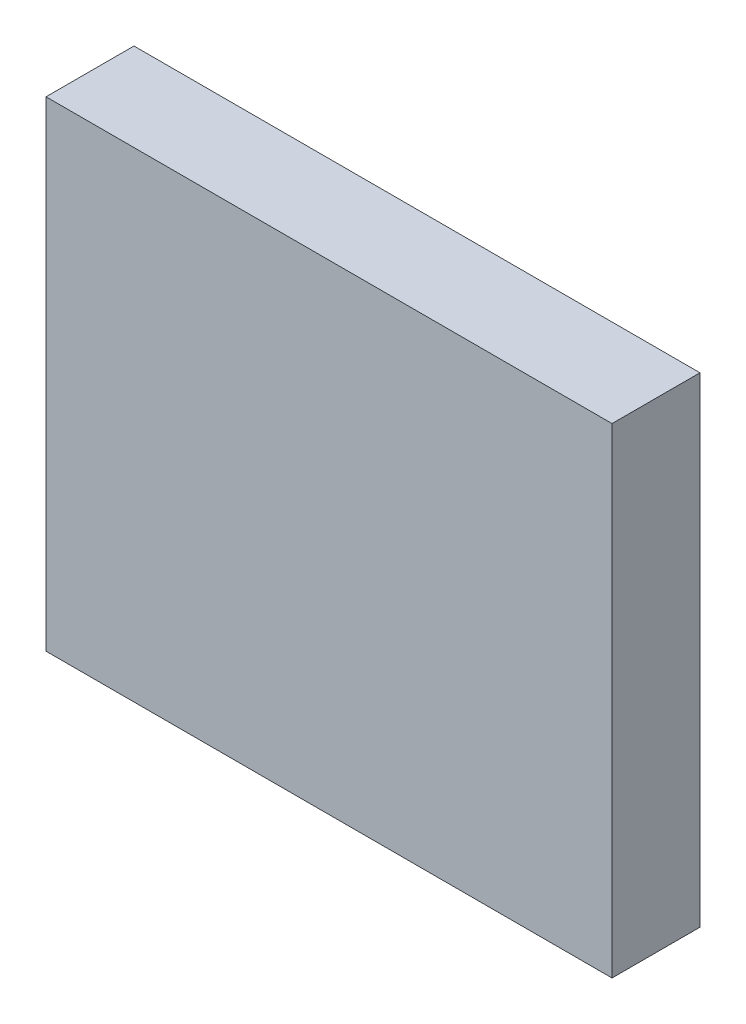
from build123d import *

# Parameters (mm, degrees)
SKETCH1_W           = 128.70828341
SKETCH1_H           = 109.190987083
BOSS_EXTRUDE1_DEPTH = 20


with BuildPart() as part:
    # Sketch1 → Boss-Extrude1 (new body)
    with BuildSketch(Plane.XY):
        with Locations((64.354141705, 54.595493542)):
            Rectangle(SKETCH1_W, SKETCH1_H)
    extrude(amount=BOSS_EXTRUDE1_DEPTH)


solid = part.part
